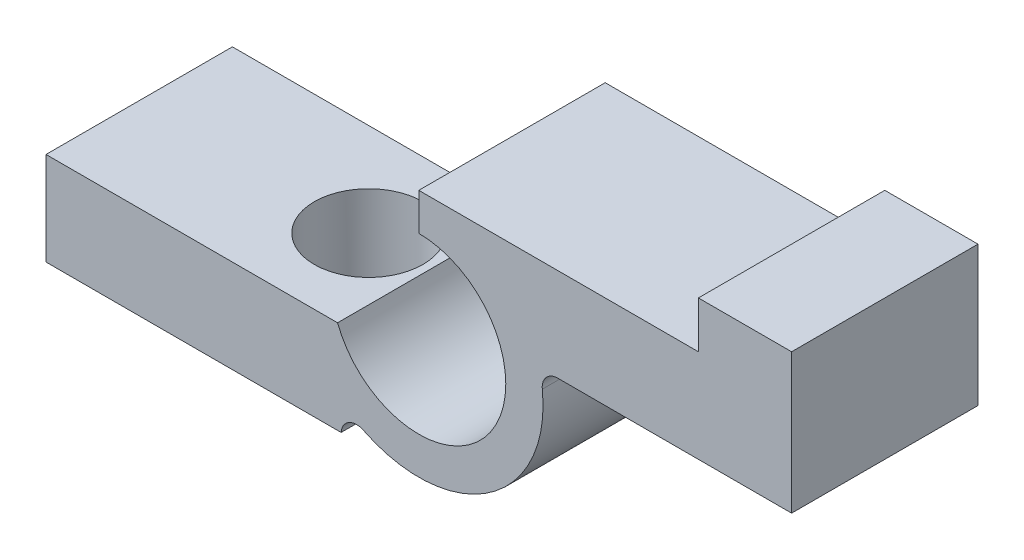
from build123d import *

# Parameters (mm, degrees)
ESBO_O1_R                  = 4
ESBO_O1_W                  = 6.5
ESBO_O1_H                  = 3
EXTRUDE1_CORPO_DEPTH       = 6
FURO_ANEL_DEPTH            = 21.591260282
FURO_ANEL_DEPTH_BACK       = 21.591260282
ESBO_O2_R                  = 2.8
ABERTURA_C_DEPTH           = 21.591260282
ABERTURA_C_DEPTH_BACK      = 21.591260282
ESBO_O3_W                  = 6
ESBO_O3_H                  = 6
FILLET_JUNCOES_R           = 0.5
ESBO_O4_W                  = 6
ESBO_O4_H                  = 3
RESSALTO_EXTRUS_O2_DEPTH   = 3
ESBO_O5_W                  = 6
ESBO_O5_H                  = 3
RESSALTO_EXTRUS_O3_DEPTH   = 3
ESBO_O6_W                  = 3
ESBO_O6_H                  = 6
RESSALTO_EXTRUS_O4_DEPTH   = 1.5
CORTE_EXTRUS_O3_DEPTH      = 23.78705773
CORTE_EXTRUS_O3_DEPTH_BACK = 23.78705773
ESBO_O7_R                  = 1.75


with BuildPart() as part:
    # Esboço1 → Extrude1_Corpo (new body)
    with BuildSketch(Plane.XY):
        with BuildLine():
            ThreePointArc((5.127016654, 3), (5.6414319, 1.827439226), (6.5, 0.877501001))
            Line((6.5, 0.877501001), (6.5, 3))
            Line((6.5, 3), (5.127016654, 3))
        make_face()
        with BuildLine():
            ThreePointArc((12.872983346, 5), (11.449489743, 7.16227766), (9, 8))
            Line((9, 8), (9, 5))
            Line((9, 5), (12.872983346, 5))
        make_face()
        with Locations((9, 4)):
            Circle(ESBO_O1_R)
        with Locations((3.25, 1.5)):
            Rectangle(ESBO_O1_W, ESBO_O1_H)
        with BuildLine():
            Line((18, 8), (9, 8))
            ThreePointArc((9, 8), (11.449489743, 7.16227766), (12.872983346, 5))
            Line((12.872983346, 5), (18, 5))
            Line((18, 5), (18, 8))
        make_face()
        with BuildLine():
            Line((6.5, 3), (6.5, 0.877501001))
            ThreePointArc((6.5, 0.877501001), (10.732050808, 0.394448725), (13, 4))
            ThreePointArc((13, 4), (12.968118785, 4.50401717), (12.872983346, 5))
            Line((12.872983346, 5), (9, 5))
            Line((9, 5), (9, 8))
            ThreePointArc((9, 8), (5.83772234, 6.449489743), (5.127016654, 3))
            Line((5.127016654, 3), (6.5, 3))
        make_face()
    extrude(amount=EXTRUDE1_CORPO_DEPTH)

    # Esboço2 → Furo_Anel (cut, two sides: drawn at the far end of the back side and taken through both)
    with BuildSketch(Plane(origin=(0, 0, 0), x_dir=(-1, 0, 0), z_dir=(0, 0, -1)).offset(-FURO_ANEL_DEPTH_BACK)):
        with Locations((-9, 4)):
            Circle(ESBO_O2_R)
    extrude(amount=FURO_ANEL_DEPTH + FURO_ANEL_DEPTH_BACK, mode=Mode.SUBTRACT)

    # Esboço3 → Abertura_C (cut, two sides: drawn at the far end of the back side and taken through both)
    with BuildSketch(Plane(origin=(0, 0, 0), x_dir=(-1, 0, 0), z_dir=(0, 0, -1)).offset(-ABERTURA_C_DEPTH_BACK)):
        with Locations((-6, 6)):
            Rectangle(ESBO_O3_W, ESBO_O3_H)
    extrude(amount=ABERTURA_C_DEPTH + ABERTURA_C_DEPTH_BACK, mode=Mode.SUBTRACT)

    # Fillet_Juncoes
    # the kernel refuses this fillet: 0.5 mm, written as the material it adds along each edge
    with BuildSketch(Plane(origin=(12.872983346, 5, 0), x_dir=(1, 0, 0), z_dir=(0, 0, 1))) as fillet_juncoes_piece_1:
        with BuildLine():
            CenterArc((0.599152609, -0.5), FILLET_JUNCOES_R, 90, 96.379370208)
            Line((0.102248614, -0.555555556), (0.092310534, -0.556666667))
            ThreePointArc((0.092310534, -0.556666667), (0.051108802, -0.277780632), (-0.009682458, -0.0025))
            Line((-0.009682458, -0.0025), (0, 0.01))
            Line((0, 0.01), (0.599152609, 0.01))
            Line((0.599152609, 0.01), (0.599152609, 0))
        make_face()
    extrude(amount=6)
    with BuildSketch(Plane(origin=(6.5, 0.877501001, 0), x_dir=(0.8430003462487853, -0.5379130191995991, 0), z_dir=(0, 0, 1))) as fillet_juncoes_piece_2:
        with BuildLine():
            CenterArc((0.909219503, -0.497131286), FILLET_JUNCOES_R, 96.140505738, 112.885380476)
            Line((0.472019213, -0.739733648), (0.463275207, -0.744585695))
            ThreePointArc((0.463275207, -0.744585695), (0.227579603, -0.375245954), (-0.008430003, -0.00537913))
            Line((-0.008430003, -0.00537913), (0.00106967, 0.009942626))
            ThreePointArc((0.00106967, 0.009942626), (0.427868002, -0.012949715), (0.854666333, 0.009942626))
            Line((0.854666333, 0.009942626), (0.855736003, 0))
        make_face()
    extrude(amount=6)

    # Esboço4 → Ressalto-extrusão2 (add)
    with BuildSketch(Plane.ZY):
        with Locations((3, 1.5)):
            Rectangle(ESBO_O4_W, ESBO_O4_H)
    extrude(amount=RESSALTO_EXTRUS_O2_DEPTH)



with BuildPart() as body_2:
    # Esboço5 → Ressalto-extrusão3 (new body)
    with BuildSketch(Plane(origin=(18, 0, 0), x_dir=(0, 0, -1), z_dir=(1, 0, 0))):
        with Locations((-3, 6.5)):
            Rectangle(ESBO_O5_W, ESBO_O5_H)
    extrude(amount=RESSALTO_EXTRUS_O3_DEPTH)


with BuildPart() as part_1:
    add(part.part)

    add(body_2.part)  # Ressalto-extrusão4 merges body 2
    # Esboço6 → Ressalto-extrusão4 (add)
    with BuildSketch(Plane(origin=(0, 8, 0), x_dir=(1, 0, 0), z_dir=(0, 1, 0))):
        with Locations((19.5, -3)):
            Rectangle(ESBO_O6_W, ESBO_O6_H)
    extrude(amount=RESSALTO_EXTRUS_O4_DEPTH)

    # Esboço7 → Corte-extrusão3 (cut, two sides: drawn at the far end of the back side and taken through both)
    with BuildSketch(Plane(origin=(0, 3, 0), x_dir=(1, 0, 0), z_dir=(0, 1, 0)).offset(-CORTE_EXTRUS_O3_DEPTH_BACK)):
        with Locations(Location((4.384660634, -3, 0), (0, 0, 270))):
            Circle(ESBO_O7_R)
    extrude(amount=CORTE_EXTRUS_O3_DEPTH + CORTE_EXTRUS_O3_DEPTH_BACK, mode=Mode.SUBTRACT)


solid = part_1.part
